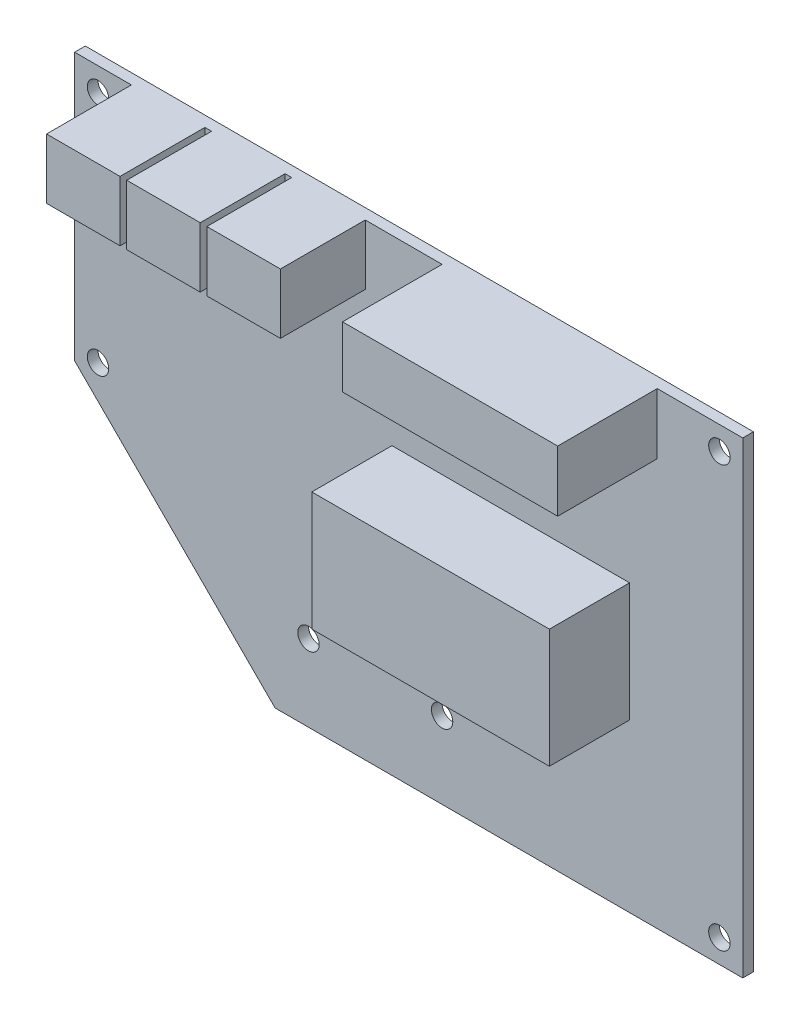
from build123d import *

# Parameters (mm, degrees)
ESQUISSE1_R        = 1.6
BOSS_EXTRU_1_DEPTH = 1.6
ESQUISSE2_W        = 11
ESQUISSE2_H        = 9
BOSS_EXTRU_2_DEPTH = 12.7
ESQUISSE3_W        = 32.2
ESQUISSE3_H        = 9.1
BOSS_EXTRU_3_DEPTH = 14.9
ESQUISSE4_W        = 35.56
ESQUISSE4_H        = 17.78
BOSS_EXTRU_4_DEPTH = 12


with BuildPart() as part:
    # Esquisse1 → Boss.-Extru.1 (new body)
    with BuildSketch(Plane.XY):
        Polygon((0, 0), (100, 0), (100, -70), (30, -70), (0, -40), align=None)
        with Locations((3.5, -3.5)):
            Circle(ESQUISSE1_R, mode=Mode.SUBTRACT)
        with Locations((96.5, -3.5)):
            Circle(ESQUISSE1_R, mode=Mode.SUBTRACT)
        with Locations((3.5, -38.5)):
            Circle(ESQUISSE1_R, mode=Mode.SUBTRACT)
        with Locations((96.5, -66.5)):
            Circle(ESQUISSE1_R, mode=Mode.SUBTRACT)
        with Locations((35, -58.5)):
            Circle(ESQUISSE1_R, mode=Mode.SUBTRACT)
        with Locations((55, -58.5)):
            Circle(ESQUISSE1_R, mode=Mode.SUBTRACT)
    extrude(amount=BOSS_EXTRU_1_DEPTH)

    # Esquisse2 → Boss.-Extru.2 (add)
    with BuildSketch(Plane.XY.offset(1.6)):
        with Locations((14, -4.5)):
            Rectangle(ESQUISSE2_W, ESQUISSE2_H)
        with Locations((26, -4.5)):
            Rectangle(ESQUISSE2_W, ESQUISSE2_H)
        with Locations((38, -4.5)):
            Rectangle(ESQUISSE2_W, ESQUISSE2_H)
    extrude(amount=BOSS_EXTRU_2_DEPTH)

    # Esquisse3 → Boss.-Extru.3 (add)
    with BuildSketch(Plane.XY.offset(1.6)):
        with Locations((71.1, -4.55)):
            Rectangle(ESQUISSE3_W, ESQUISSE3_H)
    extrude(amount=BOSS_EXTRU_3_DEPTH)

    # Esquisse4 → Boss.-Extru.4 (add)
    with BuildSketch(Plane.XY.offset(1.6)):
        with Locations((65.28, -36.14)):
            Rectangle(ESQUISSE4_W, ESQUISSE4_H)
    extrude(amount=BOSS_EXTRU_4_DEPTH)


solid = part.part
